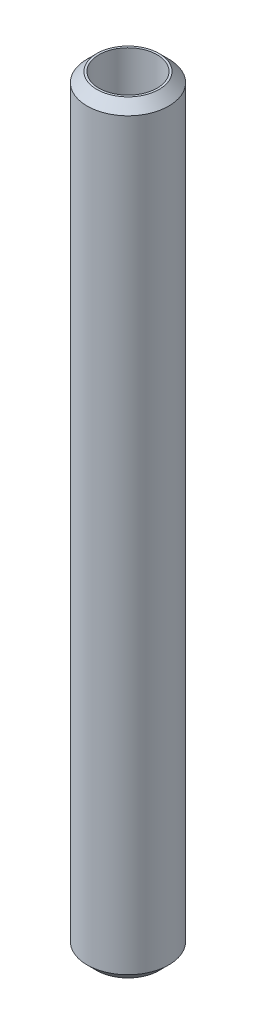
from build123d import *

# Parameters (mm, degrees)
SKETCH1_R           = 17.5
BOSS_EXTRUDE1_DEPTH = 327.471653787
SKETCH2_R           = 12.466702666
CUT_EXTRUDE1_DEPTH  = 329.405517667
CHAMFER1_SIZE       = 4.12288791


with BuildPart() as part:
    # Sketch1 → Boss-Extrude1 (new body)
    with BuildSketch(Plane(origin=(0, 0, 0), x_dir=(1, 0, 0), z_dir=(0, 1, 0))):
        Circle(SKETCH1_R)
    extrude(amount=BOSS_EXTRUDE1_DEPTH)

    # Sketch2 → Cut-Extrude1 (cut, through all)
    with BuildSketch(Plane(origin=(0, 0, 0), x_dir=(1, 0, 0), z_dir=(0, 1, 0))):
        Circle(SKETCH2_R)
    extrude(amount=CUT_EXTRUDE1_DEPTH, mode=Mode.SUBTRACT)

    # Chamfer1
    chamfer1_edges = [part.edges().sort_by_distance(p)[0] for p in [
        (-17.5, 327.471653787, 0),
        (-17.5, 0, 0),
    ]]
    chamfer(chamfer1_edges, length=CHAMFER1_SIZE)


solid = part.part
